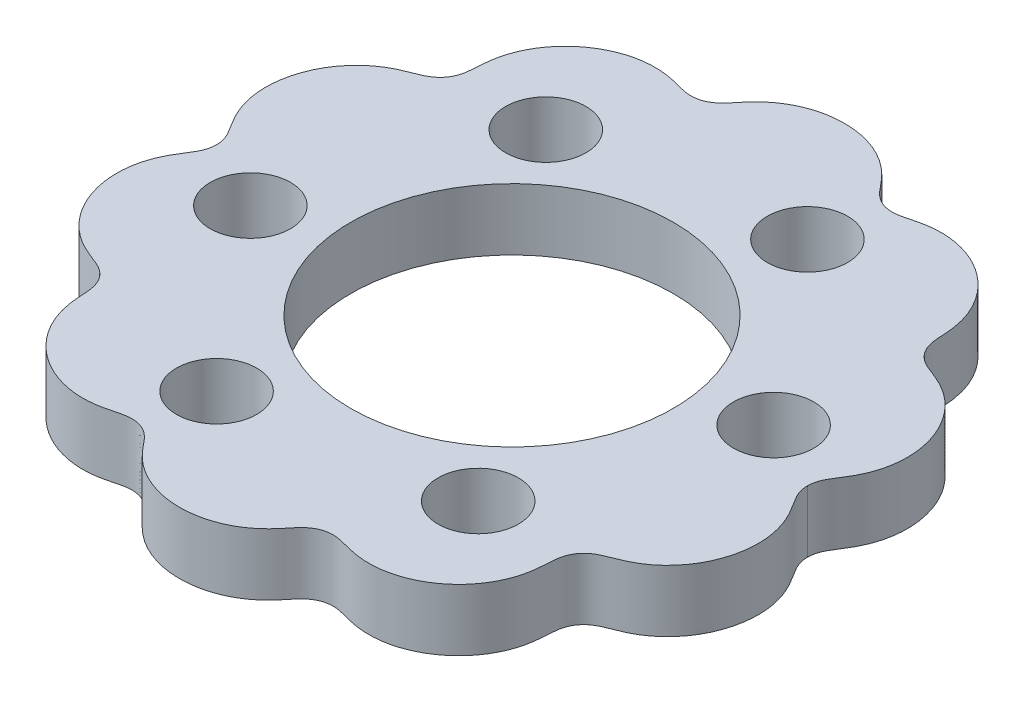
from build123d import *

# Parameters (mm, degrees)
BOSS_EXTRUDE1_DEPTH = 5
SKETCH2_R           = 13.05
CUT_EXTRUDE1_DEPTH  = 38.707841393
SKETCH3_R           = 3.25
CUT_EXTRUDE2_DEPTH  = 38.707841393
CIRPATTERN1_COUNT   = 6


with BuildPart() as part:
    # Sketch1 → Boss-Extrude1 (new body)
    with BuildSketch(Plane(origin=(0, 0, 0), x_dir=(1, 0, 0), z_dir=(0, 1, 0))):
        with BuildLine():
            add(Edge.make_bspline(
                [(23.9, 0), (23.9, -0.016633989), (23.900445322, -0.049716738), (23.903117263, -0.135350435), (23.912449323, -0.258275625), (23.931014764, -0.389664583), (23.95950077, -0.532178366), (23.991965599, -0.654750336), (24.032983907, -0.786511172), (24.083782664, -0.924885773), (24.152134694, -1.082987887), (24.242890991, -1.262939392), (24.344653165, -1.442540166), (24.455160863, -1.62253731), (24.571701309, -1.804480724), (24.718332668, -2.031272436), (24.891440754, -2.305276667), (25.08752709, -2.640233385), (25.293354955, -3.042827983), (25.523356461, -3.575365943), (25.743503693, -4.249070037), (25.90895307, -5.060229623), (25.989021701, -6.239979202), (25.864263399, -7.422194916), (25.541810184, -8.56833506), (25.032271071, -9.642344828), (24.515868766, -10.44509368), (23.898825197, -11.173556713), (23.189250761, -11.812425557), (22.506894507, -12.273540648), (21.894123423, -12.592734858), (21.380382876, -12.81286495), (20.981186658, -12.967022062), (20.508286762, -13.149650453), (20.002819314, -13.392358805), (19.516275612, -13.770444983), (19.107135549, -14.342924661), (18.904436986, -14.938672604), (18.837743288, -15.510825887), (18.811680981, -16.040809437), (18.784521574, -16.489892991), (18.724656278, -17.057834998), (18.596613672, -17.739277292), (18.286978104, -18.742891592), (17.634453661, -19.994985608), (16.567681951, -21.268872628), (15.018746131, -22.380373674), (13.232021309, -23.071186796), (11.686263401, -23.233504295), (10.520948657, -23.10721323), (9.745023474, -22.927131672), (9.331355803, -22.817516456), (8.8414507, -22.687628022), (8.289082778, -22.590399027), (7.675024184, -22.615604046), (7.013991426, -22.842464767), (6.507806015, -23.203624322), (6.123760777, -23.620439494), (5.797319915, -24.026122754), (5.516993379, -24.366413103), (4.988653796, -24.957955887), (4.121749015, -25.716255592), (2.800220177, -26.458949577), (0.986584089, -26.932274503), (-0.892508871, -26.944576885), (-2.492684707, -26.549040992), (-3.758629608, -25.923530552), (-4.601197212, -25.296224361), (-5.106881385, -24.821721344), (-5.490331154, -24.398391643), (-5.776848315, -24.051429867), (-6.109234539, -23.637738359), (-6.497134166, -23.211951019), (-7.00800434, -22.844726368), (-7.673409625, -22.615662906), (-8.289091303, -22.590403621), (-8.841445105, -22.687625059), (-9.331358863, -22.817518065), (-9.745022337, -22.927131075), (-10.520949385, -23.107213612), (-11.686262901, -23.233504033), (-13.232021627, -23.071186963), (-15.018745949, -22.380373578), (-16.567682076, -21.268872694), (-17.63445358, -19.994985565), (-18.286978155, -18.742891619), (-18.596613642, -17.739277276), (-18.724656297, -17.057835008), (-18.784521564, -16.489892985), (-18.811680987, -16.04080944), (-18.837743285, -15.510825885), (-18.904436988, -14.938672605), (-19.107135548, -14.34292466), (-19.516275613, -13.770444984), (-20.002819314, -13.392358805), (-20.508286763, -13.149650453), (-20.981186657, -12.967022061), (-21.380382877, -12.81286495), (-21.894123423, -12.592734858), (-22.506894507, -12.273540648), (-23.189250761, -11.812425557), (-23.898825197, -11.173556713), (-24.515868766, -10.44509368), (-25.032271071, -9.642344828), (-25.541810184, -8.56833506), (-25.864263399, -7.422194916), (-25.989021701, -6.239979202), (-25.90895307, -5.060229623), (-25.743503693, -4.249070037), (-25.523356461, -3.575365943), (-25.293354955, -3.042827983), (-25.08752709, -2.640233385), (-24.891440754, -2.305276667), (-24.718332668, -2.031272436), (-24.571701309, -1.804480724), (-24.455160863, -1.62253731), (-24.344653165, -1.442540166), (-24.242890991, -1.262939392), (-24.152134694, -1.082987887), (-24.083782664, -0.924885773), (-24.032983907, -0.786511172), (-23.991965599, -0.654750336), (-23.95950077, -0.532178365), (-23.931014765, -0.389664584), (-23.912449321, -0.258275624), (-23.903117265, -0.135350437), (-23.900445324, -0.049716739), (-23.9, -0.016633989), (-23.9, 0)],
                knots=[0.076870089, 0.076870089, 0.076870089, 0.076870089, 0.076870089, 0.077626864, 0.078383639, 0.079897189, 0.081410739, 0.082924289, 0.083870594, 0.084816898, 0.086709508, 0.088602118, 0.090494728, 0.092574338, 0.094653949, 0.096733559, 0.09881317, 0.102972391, 0.107131612, 0.111670975, 0.116210339, 0.125289066, 0.134368095, 0.143447123, 0.161604528, 0.17076612, 0.179927712, 0.189089676, 0.19825164, 0.207413052, 0.216574463, 0.220692039, 0.224809615, 0.228927191, 0.233044767, 0.240218222, 0.246328137, 0.252327936, 0.259784753, 0.264113126, 0.268441498, 0.27276987, 0.277098243, 0.286093979, 0.295089716, 0.313081822, 0.331073403, 0.349394218, 0.367715837, 0.386036254, 0.390153136, 0.394270018, 0.398386899, 0.402503781, 0.4096773, 0.415786121, 0.421726112, 0.429062853, 0.433304136, 0.43754542, 0.441786703, 0.446027986, 0.463837747, 0.481648122, 0.499457726, 0.517451628, 0.535445968, 0.544442792, 0.553439616, 0.557768563, 0.562097511, 0.566426458, 0.570755406, 0.578212988, 0.584213879, 0.5903227, 0.597496219, 0.601613101, 0.605729982, 0.609846864, 0.613963746, 0.632284163, 0.650605782, 0.668926597, 0.686918178, 0.704910284, 0.713906021, 0.722901757, 0.72723013, 0.731558502, 0.735886874, 0.740215247, 0.747672064, 0.753671863, 0.759781778, 0.766955233, 0.771072809, 0.775190385, 0.779307961, 0.783425537, 0.792586948, 0.80174836, 0.810910324, 0.820072288, 0.82923388, 0.838395472, 0.856552877, 0.865631905, 0.874710934, 0.883789661, 0.888329025, 0.892868388, 0.897027609, 0.90118683, 0.903266441, 0.905346051, 0.907425662, 0.909505272, 0.911397882, 0.913290492, 0.915183102, 0.916129406, 0.917075711, 0.918589261, 0.920102811, 0.921616361, 0.922373136, 0.923129911, 0.923129911, 0.923129911, 0.923129911, 0.923129911], degree=4))
            add(Edge.make_bspline(
                [(-23.9, 0), (-23.9, 0.016633989), (-23.900445322, 0.049716738), (-23.903117263, 0.135350435), (-23.912449323, 0.258275625), (-23.931014764, 0.389664583), (-23.95950077, 0.532178365), (-23.991965599, 0.654750336), (-24.032983907, 0.786511172), (-24.083782664, 0.924885773), (-24.152134694, 1.082987887), (-24.242890991, 1.262939392), (-24.344653165, 1.442540166), (-24.455160863, 1.62253731), (-24.571701309, 1.804480724), (-24.718332668, 2.031272436), (-24.891440754, 2.305276667), (-25.08752709, 2.640233385), (-25.293354955, 3.042827983), (-25.523356461, 3.575365943), (-25.743503693, 4.249070037), (-25.90895307, 5.060229623), (-25.989021701, 6.239979202), (-25.864263399, 7.422194916), (-25.541810184, 8.56833506), (-25.032271071, 9.642344828), (-24.515868766, 10.44509368), (-23.898825197, 11.173556713), (-23.189250761, 11.812425557), (-22.506894507, 12.273540648), (-21.894123423, 12.592734858), (-21.380382876, 12.81286495), (-20.981186658, 12.967022062), (-20.508286762, 13.149650453), (-20.002819314, 13.392358805), (-19.516275612, 13.770444983), (-19.107135549, 14.342924661), (-18.904436986, 14.938672604), (-18.837743288, 15.510825887), (-18.811680981, 16.040809437), (-18.784521574, 16.489892991), (-18.724656278, 17.057834998), (-18.596613672, 17.739277292), (-18.286978104, 18.742891592), (-17.634453661, 19.994985608), (-16.567681951, 21.268872628), (-15.018746131, 22.380373674), (-13.232021309, 23.071186796), (-11.686263401, 23.233504295), (-10.520948657, 23.10721323), (-9.745023474, 22.927131672), (-9.331355803, 22.817516456), (-8.8414507, 22.687628022), (-8.289082778, 22.590399027), (-7.675024184, 22.615604046), (-7.013991426, 22.842464767), (-6.507806015, 23.203624322), (-6.123760777, 23.620439494), (-5.797319915, 24.026122754), (-5.516993379, 24.366413103), (-4.988653796, 24.957955887), (-4.121749015, 25.716255592), (-2.800220177, 26.458949577), (-0.986584089, 26.932274503), (0.892508871, 26.944576885), (2.492684707, 26.549040992), (3.758629608, 25.923530552), (4.601197212, 25.296224361), (5.106881385, 24.821721344), (5.490331154, 24.398391643), (5.776848315, 24.051429867), (6.109234539, 23.637738359), (6.497134166, 23.211951019), (7.00800434, 22.844726368), (7.673409625, 22.615662906), (8.289091303, 22.590403621), (8.841445105, 22.687625059), (9.331358863, 22.817518065), (9.745022337, 22.927131075), (10.520949385, 23.107213612), (11.686262901, 23.233504033), (13.232021627, 23.071186963), (15.018745949, 22.380373578), (16.567682076, 21.268872694), (17.63445358, 19.994985565), (18.286978155, 18.742891619), (18.596613642, 17.739277276), (18.724656297, 17.057835008), (18.784521564, 16.489892985), (18.811680987, 16.04080944), (18.837743285, 15.510825885), (18.904436988, 14.938672605), (19.107135548, 14.34292466), (19.516275613, 13.770444984), (20.002819314, 13.392358805), (20.508286763, 13.149650453), (20.981186657, 12.967022061), (21.380382877, 12.81286495), (21.894123423, 12.592734858), (22.506894507, 12.273540648), (23.189250761, 11.812425557), (23.898825197, 11.173556713), (24.515868766, 10.44509368), (25.032271071, 9.642344828), (25.541810184, 8.56833506), (25.864263399, 7.422194915), (25.989021701, 6.239979203), (25.90895307, 5.060229621), (25.743503693, 4.249070041), (25.523356461, 3.575365937), (25.293354955, 3.042827994), (25.08752709, 2.640233361), (24.891440754, 2.30527671), (24.718332668, 2.031272365), (24.571701309, 1.804480847), (24.455160863, 1.622537048), (24.344653165, 1.442540618), (24.242890991, 1.262938646), (24.152134694, 1.08298926), (24.083782664, 0.92488324), (24.032983907, 0.786515802), (23.991965599, 0.654738614), (23.95950077, 0.53221509), (23.931014764, 0.389575382), (23.912449323, 0.258442601), (23.903117262, 0.135032083), (23.900445327, 0.050068621), (23.9, 0.01663399), (23.9, 0)],
                knots=[0.076870089, 0.076870089, 0.076870089, 0.076870089, 0.076870089, 0.077626864, 0.078383639, 0.079897189, 0.081410739, 0.082924289, 0.083870594, 0.084816898, 0.086709508, 0.088602118, 0.090494728, 0.092574338, 0.094653949, 0.096733559, 0.09881317, 0.102972391, 0.107131612, 0.111670975, 0.116210339, 0.125289066, 0.134368095, 0.143447123, 0.161604528, 0.17076612, 0.179927712, 0.189089676, 0.19825164, 0.207413052, 0.216574463, 0.220692039, 0.224809615, 0.228927191, 0.233044767, 0.240218222, 0.246328137, 0.252327936, 0.259784753, 0.264113126, 0.268441498, 0.27276987, 0.277098243, 0.286093979, 0.295089716, 0.313081822, 0.331073403, 0.349394218, 0.367715837, 0.386036254, 0.390153136, 0.394270018, 0.398386899, 0.402503781, 0.4096773, 0.415786121, 0.421726112, 0.429062853, 0.433304136, 0.43754542, 0.441786703, 0.446027986, 0.463837747, 0.481648122, 0.499457726, 0.517451628, 0.535445968, 0.544442792, 0.553439616, 0.557768563, 0.562097511, 0.566426458, 0.570755406, 0.578212988, 0.584213879, 0.5903227, 0.597496219, 0.601613101, 0.605729982, 0.609846864, 0.613963746, 0.632284163, 0.650605782, 0.668926597, 0.686918178, 0.704910284, 0.713906021, 0.722901757, 0.72723013, 0.731558502, 0.735886874, 0.740215247, 0.747672064, 0.753671863, 0.759781778, 0.766955233, 0.771072809, 0.775190385, 0.779307961, 0.783425537, 0.792586948, 0.80174836, 0.810910324, 0.820072288, 0.82923388, 0.838395472, 0.856552877, 0.865631905, 0.874710934, 0.883789661, 0.888329025, 0.892868388, 0.897027609, 0.90118683, 0.903266441, 0.905346051, 0.907425662, 0.909505272, 0.911397882, 0.913290492, 0.915183102, 0.916129406, 0.917075711, 0.918589261, 0.920102811, 0.921616361, 0.922373136, 0.923129911, 0.923129911, 0.923129911, 0.923129911, 0.923129911], degree=4))
        make_face()
    extrude(amount=BOSS_EXTRUDE1_DEPTH)

    # Sketch2 → Cut-Extrude1 (cut, through all)
    with BuildSketch(Plane(origin=(0, 5, 0), x_dir=(1, 0, 0), z_dir=(0, 1, 0))):
        Circle(SKETCH2_R)
    extrude(amount=-CUT_EXTRUDE1_DEPTH, mode=Mode.SUBTRACT)

    # Sketch3 → Cut-Extrude2 (cut, through all)
    with BuildSketch(Plane(origin=(0, 5, 0), x_dir=(1, 0, 0), z_dir=(0, 1, 0))):
        with Locations((18.272234301, 2.894037603)):
            Circle(SKETCH3_R)
    cut_extrude2 = extrude(amount=-CUT_EXTRUDE2_DEPTH, mode=Mode.SUBTRACT)

    # CirPattern1: Cut-Extrude2 ×6 about axis
    cirpattern1_axis = Axis((0, 5, 0), (0, 1, 0))
    for i in range(1, CIRPATTERN1_COUNT):
        add(cut_extrude2.rotate(cirpattern1_axis, i * 360 / CIRPATTERN1_COUNT), mode=Mode.SUBTRACT)


solid = part.part
